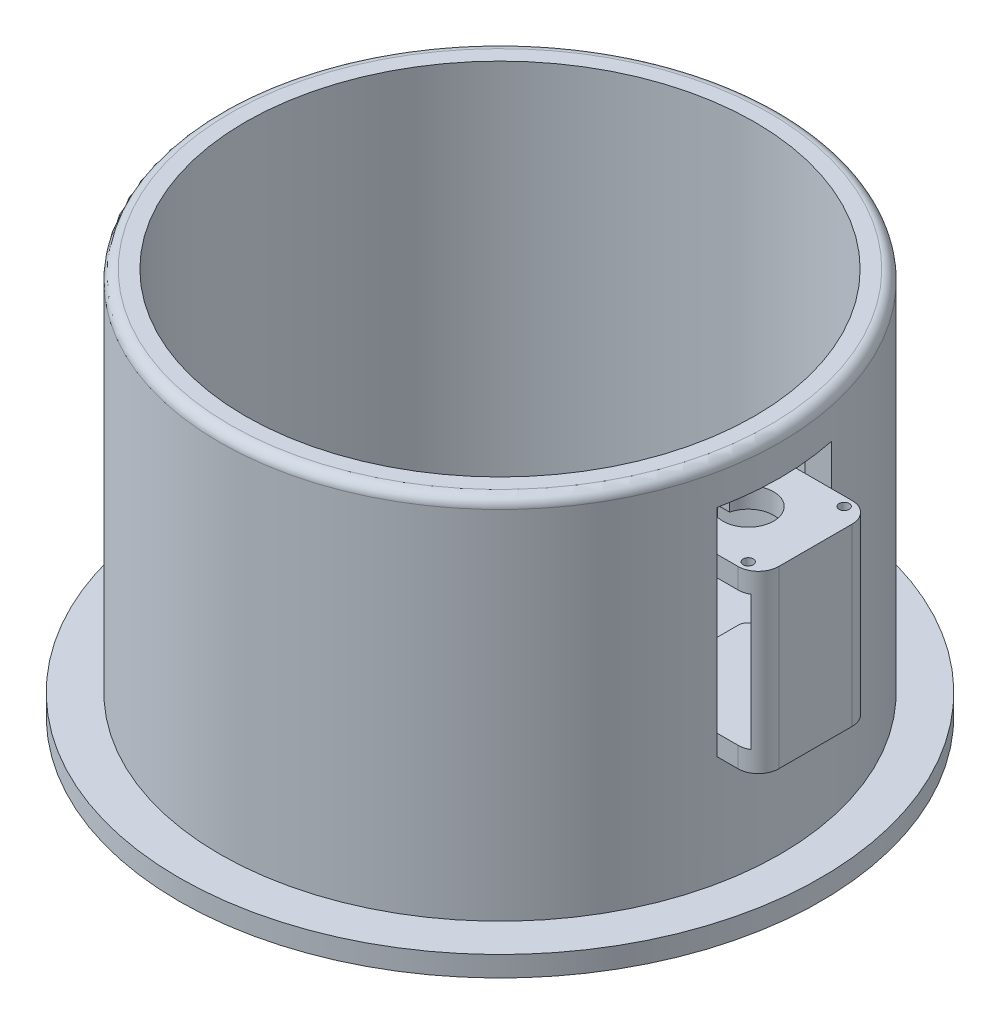
from build123d import *

# Parameters (mm, degrees)
SKETCH1_R           = 137.5
SKETCH1_R_2         = 125
BOSS_EXTRUDE1_DEPTH = 180
SKETCH2_R           = 157.5
BOSS_EXTRUDE2_DEPTH = 10
SKETCH3_R           = 52.5
SKETCH3_R_2         = 47.5
BOSS_EXTRUDE3_DEPTH = 20
SKETCH4_W           = 56
SKETCH4_H           = 96
CUT_EXTRUDE4_DEPTH  = 150
SKETCH5_W           = 56
SKETCH5_H           = 10
BOSS_EXTRUDE4_DEPTH = 56
SKETCH6_W           = 56
SKETCH6_H           = 56
BOSS_EXTRUDE5_DEPTH = 10
SKETCH7_R           = 2.5
SKETCH7_R_2         = 12.5
CUT_EXTRUDE5_DEPTH  = 10
SKETCH8_W           = 56
SKETCH8_H           = 86
BOSS_EXTRUDE6_DEPTH = 5
FILLET1_R           = 10
FILLET2_R           = 5
SKETCH9_W           = 31.730677801
SKETCH9_H           = 6
CUT_EXTRUDE6_DEPTH  = 10
FILLET3_R           = 5
CUT_EXTRUDE7_START  = -2
SKETCH10_R          = 47.5
CUT_EXTRUDE7_DEPTH  = 2


with BuildPart() as part:
    # Sketch1 → Boss-Extrude1 (new body)
    with BuildSketch(Plane(origin=(0, 0, 0), x_dir=(1, 0, 0), z_dir=(0, 1, 0))):
        with Locations(Location((0, 0, 0), (0, 0, 90))):
            Circle(SKETCH1_R)
        with Locations(Location((0, 0, 0), (0, 0, 90))):
            Circle(SKETCH1_R_2, mode=Mode.SUBTRACT)
    extrude(amount=BOSS_EXTRUDE1_DEPTH)

    # Sketch2 → Boss-Extrude2 (add)
    with BuildSketch(Plane.XZ):
        with Locations(Location((0, 0, 0), (0, 0, 270))):
            Circle(SKETCH2_R)
    extrude(amount=BOSS_EXTRUDE2_DEPTH)

    # Sketch3 → Boss-Extrude3 (add)
    with BuildSketch(Plane(origin=(0, 0, 0), x_dir=(1, 0, 0), z_dir=(0, 1, 0))):
        with Locations(Location((0, 0, 0), (0, 0, 90))):
            Circle(SKETCH3_R)
        with Locations(Location((0, 0, 0), (0, 0, 270))):
            Circle(SKETCH3_R_2, mode=Mode.SUBTRACT)
    extrude(amount=BOSS_EXTRUDE3_DEPTH)

    # Sketch4 → Cut-Extrude4 (cut)
    with BuildSketch(Plane(origin=(0, 0, 0), x_dir=(0, 0, -1), z_dir=(1, 0, 0))):
        with Locations((0, 112)):
            Rectangle(SKETCH4_W, SKETCH4_H)
    extrude(amount=CUT_EXTRUDE4_DEPTH, mode=Mode.SUBTRACT)

    # Sketch5 → Boss-Extrude4 (add)
    with BuildSketch(Plane(origin=(0, 0, 28), x_dir=(-1, 0, 0), z_dir=(0, 0, -1))):
        with Locations((-121.823643025, 135)):
            Rectangle(SKETCH5_W, SKETCH5_H)
    extrude(amount=BOSS_EXTRUDE4_DEPTH)

    # Sketch6 → Boss-Extrude5 (add)
    with BuildSketch(Plane(origin=(0, 64, 0), x_dir=(1, 0, 0), z_dir=(0, 1, 0))):
        with Locations((121.823643025, 0)):
            Rectangle(SKETCH6_W, SKETCH6_H)
    extrude(amount=-BOSS_EXTRUDE5_DEPTH)

    # Sketch7 → Cut-Extrude5 (cut)
    with BuildSketch(Plane(origin=(0, 140, 0), x_dir=(1, 0, 0), z_dir=(0, 1, 0))):
        with Locations(Location((98.273643025, 23.55, 0), (0, 0, 270))):
            Circle(SKETCH7_R)
        with Locations(Location((145.373643025, 23.55, 0), (0, 0, 270))):
            Circle(SKETCH7_R)
        with Locations(Location((98.273643025, -23.55, 0), (0, 0, 270))):
            Circle(SKETCH7_R)
        with Locations(Location((145.373643025, -23.55, 0), (0, 0, 270))):
            Circle(SKETCH7_R)
        with Locations(Location((121.823643025, 0, 0), (0, 0, 270))):
            Circle(SKETCH7_R_2)
    extrude(amount=-CUT_EXTRUDE5_DEPTH, mode=Mode.SUBTRACT)

    # Sketch8 → Boss-Extrude6 (add)
    with BuildSketch(Plane(origin=(149.823643025, 0, 0), x_dir=(0, 0, -1), z_dir=(1, 0, 0))):
        with Locations((0, 97)):
            Rectangle(SKETCH8_W, SKETCH8_H)
    extrude(amount=BOSS_EXTRUDE6_DEPTH)

    # Fillet1
    # the kernel refuses this fillet: 10 mm, written as the material it takes off along each edge
    with BuildSketch(Plane(origin=(154.823643025, 165, -28), x_dir=(0, 0, 1), z_dir=(0, -1, 0)), Plane(origin=(154.823643025, 29, 28), x_dir=(0, 0, -1), z_dir=(0, 1, 0))) as fillet1_piece_1:
        with BuildLine():
            CenterArc((FILLET1_R, FILLET1_R), FILLET1_R, 180, 90)
            Line((0, FILLET1_R), (0, 0))
            Line((0, 0), (FILLET1_R, 0))
        make_face()
    extrude(amount=136, mode=Mode.SUBTRACT)

    # Fillet2
    fillet2_edges = [part.edges().sort_by_distance(p)[0] for p in [
        (93.823643025, 135, -28),
        (93.823643025, 135, 28),
        (93.823643025, 59, 28),
        (93.823643025, 59, -28),
    ]]
    fillet(fillet2_edges, radius=FILLET2_R)

    # Sketch9 → Cut-Extrude6 (cut)
    with BuildSketch(Plane(origin=(0, 140, 0), x_dir=(1, 0, 0), z_dir=(0, 1, 0))):
        with Locations((93.823643026, 0)):
            Rectangle(SKETCH9_W, SKETCH9_H)
    extrude(amount=-CUT_EXTRUDE6_DEPTH, mode=Mode.SUBTRACT)

    # Fillet3
    fillet3_edges = [part.edges().sort_by_distance(p)[0] for p in [
        (0, 180, 137.5),
    ]]
    fillet(fillet3_edges, radius=FILLET3_R)

    # Sketch10 → Cut-Extrude7 (cut)
    with BuildSketch(Plane(origin=(0, 0, 0), x_dir=(1, 0, 0), z_dir=(0, 1, 0)).offset(CUT_EXTRUDE7_START)):
        with Locations(Location((0, 0, 0), (0, 0, 270))):
            Circle(SKETCH10_R)
    extrude(amount=CUT_EXTRUDE7_DEPTH, mode=Mode.SUBTRACT)


solid = part.part
